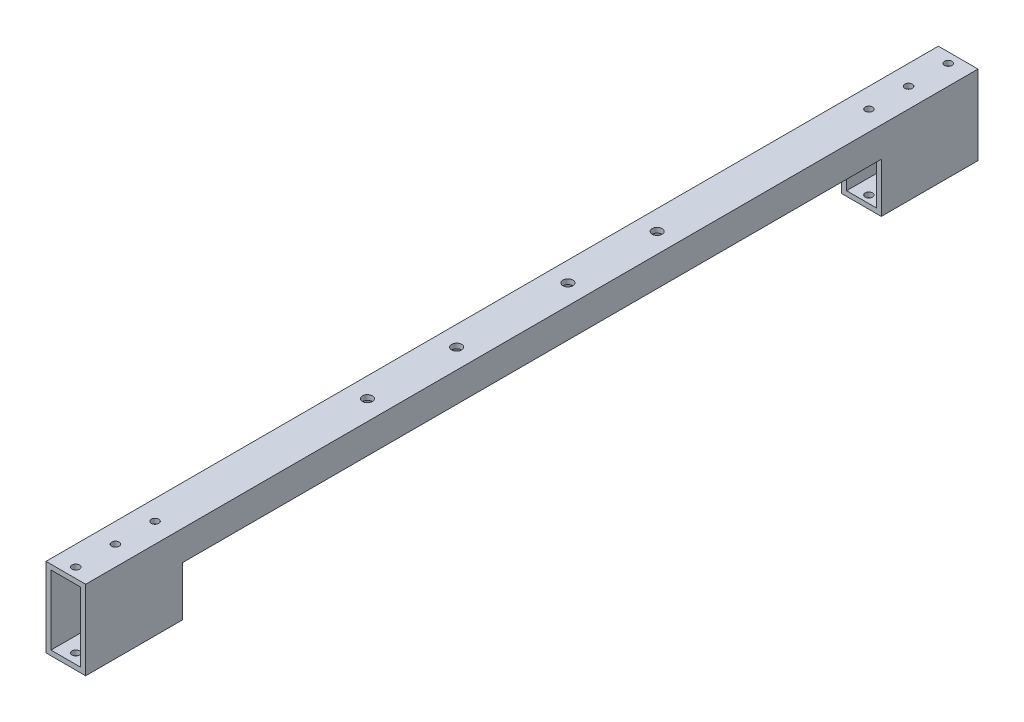
from build123d import *

# Parameters (mm, degrees)
SKETCH1_W                      = 25.4
SKETCH1_H                      = 50.8
SKETCH1_W_2                    = 19.05
SKETCH1_H_2                    = 44.45
EXTRUDE_THIN1_DEPTH            = 571.5
F_3_16_0_1875_DIAMETER_HOLE1_D = 4.7625
F_1_4_0_25_DIAMETER_HOLE1_D    = 6.35
SKETCH10_W                     = 447.6496
SKETCH10_H                     = 31.75
CUT_EXTRUDE1_DEPTH             = 573.627776134


with BuildPart() as part:
    # Sketch1 → Extrude-Thin1 (new body)
    with BuildSketch(Plane.XY):
        Rectangle(SKETCH1_W, SKETCH1_H)
        Rectangle(SKETCH1_W_2, SKETCH1_H_2, mode=Mode.SUBTRACT)
    extrude(amount=EXTRUDE_THIN1_DEPTH)

    # 3/16 (0.1875) Diameter Hole1 (through all)
    with Locations(Plane(origin=(0, 25.4, 565.15), x_dir=(0, 0, 1), z_dir=(0, 1, 0))):
        with Locations((0, 0), (-558.8, 0), (-533.4, 0), (-508, 0), (-25.4, 0), (-50.8, 0)):
            Hole(F_3_16_0_1875_DIAMETER_HOLE1_D / 2)

    # 1/4 (0.25) Diameter Hole1 (through all)
    with Locations(Plane(origin=(0, 25.4, 0), x_dir=(1, 0, 0), z_dir=(0, 1, 0))):
        with Locations((0, -321.183), (0, -378.333), (0, -192.786), (0, -249.936)):
            Hole(F_1_4_0_25_DIAMETER_HOLE1_D / 2)

    # Sketch10 → Cut-Extrude1 (cut, through all)
    with BuildSketch(Plane(origin=(12.7, 0, 0), x_dir=(0, 0, -1), z_dir=(1, 0, 0))):
        with Locations((-285.75, -9.525)):
            Rectangle(SKETCH10_W, SKETCH10_H)
    extrude(amount=-CUT_EXTRUDE1_DEPTH, mode=Mode.SUBTRACT)


solid = part.part
